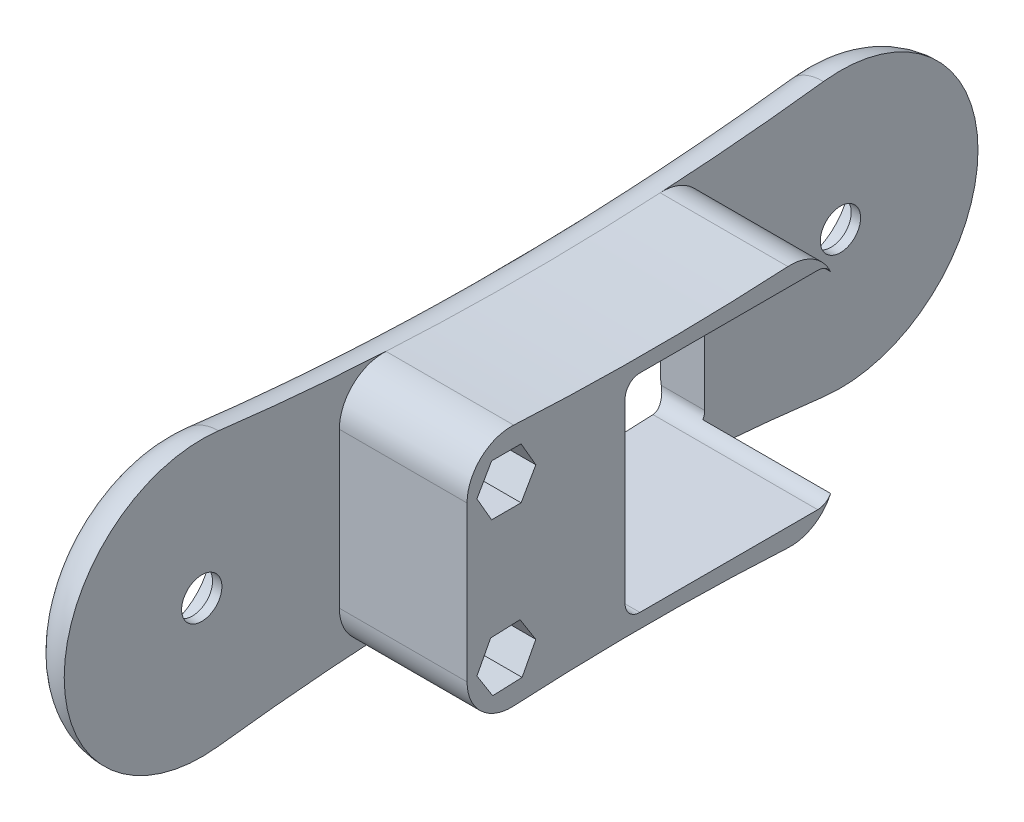
from build123d import *

# Parameters (mm, degrees)
BOSS_EXTRUDE1_DEPTH     = 35
CUT_EXTRUDE1_DEPTH      = 165.23458831805192
CUT_EXTRUDE1_DEPTH_BACK = 165.23458831805192
CUT_EXTRUDE2_DEPTH      = 165.23458831805192
CUT_EXTRUDE3_DEPTH      = 165.23458831805192
CUT_EXTRUDE4_REACH      = 166.235
SKETCH7_R               = 4.1
SKETCH7_R_2             = 4.099999999999986
SKETCH7_3_R             = 11.1
CUT_EXTRUDE5_DEPTH      = 7.1
FILLET1_R               = 9
FILLET2_START           = 9
FILLET2_DEPTH           = 26


with BuildPart() as part:
    # Sketch1 → Boss-Extrude1 (new body)
    with BuildSketch(Plane(origin=(0, 0, 0), x_dir=(0, 0, -1), z_dir=(1, 0, 0))):
        with BuildLine():
            ThreePointArc((-3.4331525583588727, 27.788729073331762), (-20.97770568525129, 18.545507924642443), (-28, 3.43e-15))
            Line((-28, 0), (28, 0))
            ThreePointArc((28, 0), (18.545507924642447, 20.977705685251287), (-3.4331525583588727, 27.788729073331762))
        make_face()
        with BuildLine():
            Line((28, 0), (-28, 0))
            ThreePointArc((-28, 3.43e-15), (-20.977705685251298, -18.545507924642436), (-3.433152558358892, -27.78872907333176))
            ThreePointArc((-3.433152558358892, -27.78872907333176), (18.545507924642436, -20.977705685251298), (28, -6.86e-15))
        make_face()
        with BuildLine():
            ThreePointArc((-126.56684744164114, 27.788729073331766), (-109.02229431474872, 18.54550792464245), (-102, 0))
            Line((-102, 0), (-28, 0))
            ThreePointArc((-28, 3.43e-15), (-20.97770568525129, 18.545507924642443), (-3.4331525583588727, 27.788729073331762))
            ThreePointArc((-3.433152558358863, 27.788729073331695), (-65, 23.999999999999602), (-126.56684744164116, 27.788729073331638))
        make_face()
        with BuildLine():
            Line((-28, 0), (-102, 0))
            ThreePointArc((-102, -6.86e-15), (-109.0222943147487, -18.545507924642447), (-126.56684744164114, -27.788729073331766))
            ThreePointArc((-126.56684744164116, -27.788729073331638), (-65, -23.999999999999602), (-3.433152558358863, -27.788729073331695))
            ThreePointArc((-3.433152558358892, -27.78872907333176), (-20.977705685251298, -18.545507924642436), (-28, 3.43e-15))
        make_face()
        with BuildLine():
            ThreePointArc((-126.56684744164114, 27.788729073331766), (-148.54550792464244, 20.977705685251287), (-158, 3.43e-15))
            Line((-158, 0), (-102, 0))
            ThreePointArc((-102, 0), (-109.02229431474872, 18.54550792464245), (-126.56684744164114, 27.788729073331766))
        make_face()
        with BuildLine():
            Line((-102, 0), (-158, 0))
            ThreePointArc((-158, 3.43e-15), (-148.54550792464244, -20.97770568525128), (-126.56684744164114, -27.788729073331766))
            ThreePointArc((-126.56684744164114, -27.788729073331766), (-109.0222943147487, -18.545507924642447), (-102, -6.86e-15))
        make_face()
    extrude(amount=BOSS_EXTRUDE1_DEPTH)

    # Sketch4 → Cut-Extrude1 (cut, two sides: drawn at the far end of the back side and taken through both)
    with BuildSketch(Plane(origin=(0, 0, 0), x_dir=(1, 0, 0), z_dir=(0, 1, 0)).offset(-CUT_EXTRUDE1_DEPTH_BACK)):
        Polygon((8.999999999999998, 27.999999999999996), (61, 27.999999999999996), (61, -28.000000000000004), (9.000000000000005, -28.000000000000004), align=None)
        Polygon((60.999999999999986, -157.99999999999997), (60.99999999999993, -101.99999999999999), (8.999999999999956, -101.99999999999999), (8.99999999999997, -157.99999999999997), align=None)
    extrude(amount=CUT_EXTRUDE1_DEPTH + CUT_EXTRUDE1_DEPTH_BACK, mode=Mode.SUBTRACT)

    # Sketch6 → Cut-Extrude2 (cut, through all)
    with BuildSketch(Plane(origin=(0, 0, 0), x_dir=(0, 0, -1), z_dir=(1, 0, 0))):
        with BuildLine():
            Line((-30.624999999999996, -21.1), (-66.82499999999999, -21.100000000000005))
            ThreePointArc((-66.82499999999999, -21.100000000000005), (-68.94632034355963, -20.221320343559647), (-69.825, -18.100000000000005))
            Line((-69.825, -18.100000000000005), (-69.825, 18.099999999999998))
            ThreePointArc((-69.825, 18.099999999999998), (-68.94632034355963, 20.22132034355964), (-66.82499999999999, 21.099999999999998))
            Line((-66.82499999999999, 21.099999999999998), (-30.624999999999996, 21.1))
            ThreePointArc((-30.624999999999996, 21.1), (-28.503679656440355, 20.221320343559643), (-27.624999999999996, 18.1))
            Line((-27.624999999999996, 18.1), (-27.624999999999996, -18.1))
            ThreePointArc((-27.624999999999996, -18.1), (-28.503679656440355, -20.221320343559643), (-30.624999999999996, -21.1))
        make_face()
    extrude(amount=CUT_EXTRUDE2_DEPTH, mode=Mode.SUBTRACT)

    # Sketch8 → Cut-Extrude3 (cut, through all)
    with BuildSketch(Plane(origin=(0, 0, 0), x_dir=(0, 0, -1), z_dir=(1, 0, 0))):
        Polygon((-99.99999999999986, 15.499999999999991), (-96.9999999999999, 10.303847577293476), (-91.00000000000006, 10.303847577293476), (-88.00000000000014, 15.500000000000032), (-91.00000000000013, 20.696152422706533), (-96.99999999999999, 20.69615242270647), align=None)
        Polygon((-99.99521646144645, -15.739540352344857), (-96.7901602003611, -20.811779932971724), (-90.79494373891465, -20.57223958062687), (-88.00478353855354, -15.26045964765515), (-91.20983979963889, -10.188220067028302), (-97.20505626108536, -10.427760419373156), align=None)
    extrude(amount=CUT_EXTRUDE3_DEPTH, mode=Mode.SUBTRACT)

    # Sketch7 → Cut-Extrude4 (cut, up to next)
    with BuildSketch(Plane(origin=(0, 0, 0), x_dir=(0, 0, -1), z_dir=(1, 0, 0)), mode=Mode.PRIVATE) as cut_extrude4_sk1:
        with Locations(Location((0, 0, 0), (0, 0, 180))):
            Circle(SKETCH7_R)
    cut_extrude4_tool1 = extrude(cut_extrude4_sk1.sketch, amount=CUT_EXTRUDE4_REACH, mode=Mode.PRIVATE) & part.part
    # Sketch7 → Cut-Extrude4 (cut, up to next)
    with BuildSketch(Plane(origin=(0, 0, 0), x_dir=(0, 0, -1), z_dir=(1, 0, 0)), mode=Mode.PRIVATE) as cut_extrude4_sk2:
        with Locations(Location((-130, 0, 0), (0, 0, 180))):
            Circle(SKETCH7_R_2)
    cut_extrude4_tool2 = extrude(cut_extrude4_sk2.sketch, amount=CUT_EXTRUDE4_REACH, mode=Mode.PRIVATE) & part.part
    add(cut_extrude4_tool1.solids().sort_by_distance((0, 0, 0))[0], mode=Mode.SUBTRACT)
    add(cut_extrude4_tool2.solids().sort_by_distance((0, 0, 130))[0], mode=Mode.SUBTRACT)

    # Sketch7<3> → Cut-Extrude5 (cut)
    with BuildSketch(Plane(origin=(0, 0, 0), x_dir=(0, 0, -1), z_dir=(1, 0, 0))):
        Circle(SKETCH7_3_R)
        with Locations((-130, 0)):
            Circle(SKETCH7_3_R)
    extrude(amount=CUT_EXTRUDE5_DEPTH, mode=Mode.SUBTRACT)

    # Fillet1
    # the kernel refuses this fillet: 9 mm, written as the material it takes off along each edge
    with BuildSketch(Plane(origin=(0, -7.11e-15, 130), x_dir=(0, 0.9924546097618487, -0.12261259136995861), z_dir=(0, -0.12261259136995861, -0.9924546097618487))) as fillet1_piece_1:
        with BuildLine():
            CenterArc((28 - FILLET1_R, FILLET1_R), FILLET1_R, 270, 89.99999999999999)
            Line((28, FILLET1_R), (28, 0))
            Line((28, 0), (28 - FILLET1_R, 0))
        make_face()
    revolve(axis=Axis((0, -7.11e-15, 130), (1, 0, 0)), revolution_arc=194.0858135076888, mode=Mode.SUBTRACT)
    with BuildSketch(Plane(origin=(0, 526.1249999999663, 65.00000000000024), x_dir=(0, -0.9924546097618476, -0.12261259136996856), z_dir=(0, 0.12261259136996856, -0.9924546097618476))) as fillet1_piece_2:
        with BuildLine():
            CenterArc((502.12499999996675 + FILLET1_R, -FILLET1_R), FILLET1_R, 90, 90)
            Line((502.12499999996675 + FILLET1_R, 1.78e-15), (502.12499999996675, 0))
            Line((502.12499999996675, 0), (502.12499999996675, -FILLET1_R))
        make_face()
    revolve(axis=Axis((0, 526.1249999999663, 65.00000000000024), (-1, 0, 0)), revolution_arc=14.085813507689899, mode=Mode.SUBTRACT)
    with BuildSketch(Plane(origin=(0, 1.78e-15, -1.78e-15), x_dir=(0, -0.9924546097618486, 0.12261259136995943), z_dir=(0, 0.12261259136995943, 0.9924546097618486))) as fillet1_piece_3:
        with BuildLine():
            CenterArc((28 - FILLET1_R, FILLET1_R), FILLET1_R, 270, 90)
            Line((27.999999999999996, FILLET1_R), (28, 0))
            Line((28, 0), (28 - FILLET1_R, 0))
        make_face()
    revolve(axis=Axis((0, 1.78e-15, -1.78e-15), (1, 0, 0)), revolution_arc=194.0858135076889, mode=Mode.SUBTRACT)
    with BuildSketch(Plane(origin=(0, -526.1249999999588, 65.00000000000026), x_dir=(0, 0.9924546097618475, 0.12261259136996942), z_dir=(0, -0.12261259136996942, 0.9924546097618475))) as fillet1_piece_4:
        with BuildLine():
            CenterArc((502.1249999999594 + FILLET1_R, -FILLET1_R), FILLET1_R, 90, 90)
            Line((502.1249999999594 + FILLET1_R, 1.78e-15), (502.1249999999594, 0))
            Line((502.1249999999594, 0), (502.1249999999594, -FILLET1_R))
        make_face()
    revolve(axis=Axis((0, -526.1249999999588, 65.00000000000026), (-1, 0, 0)), revolution_arc=14.085813507690109, mode=Mode.SUBTRACT)

    # Fillet2: read off the stored shape, not the designer's step
    # Fillet2 outline → Fillet2 (cut)
    with BuildSketch(Plane.YZ.offset(FILLET2_START)):
        with BuildLine():
            ThreePointArc((25.365061881, 28), (25.062921918, 32.34560469), (24.798492486, 36.693666988))
            ThreePointArc((24.798492486, 36.693666988), (23.518514891, 31.536360045), (19.552368755, 28))
            Line((19.552368755, 28), (25.365061881, 28))
        make_face()
        with BuildLine():
            Line((25.365061881, 102), (15.767511934, 102))
            ThreePointArc((15.767511934, 102), (22.303461396, 99.187193599), (24.753997417, 92.506969919))
            ThreePointArc((24.753997417, 92.506969919), (25.037048655, 97.254932057), (25.365061881, 102))
        make_face()
        with BuildLine():
            ThreePointArc((-25.365061881, 102), (-25.037048655, 97.254932057), (-24.753997417, 92.506969919))
            ThreePointArc((-24.753997417, 92.506969919), (-22.303461396, 99.187193599), (-15.767511934, 102))
            Line((-15.767511934, 102), (-25.365061881, 102))
        make_face()
        with BuildLine():
            ThreePointArc((-19.552368755, 28), (-23.518514891, 31.536360045), (-24.798492486, 36.693666988))
            ThreePointArc((-24.798492486, 36.693666988), (-25.062921918, 32.34560469), (-25.365061881, 28))
            Line((-25.365061881, 28), (-19.552368755, 28))
        make_face()
    extrude(amount=FILLET2_DEPTH, mode=Mode.SUBTRACT)


solid = part.part
